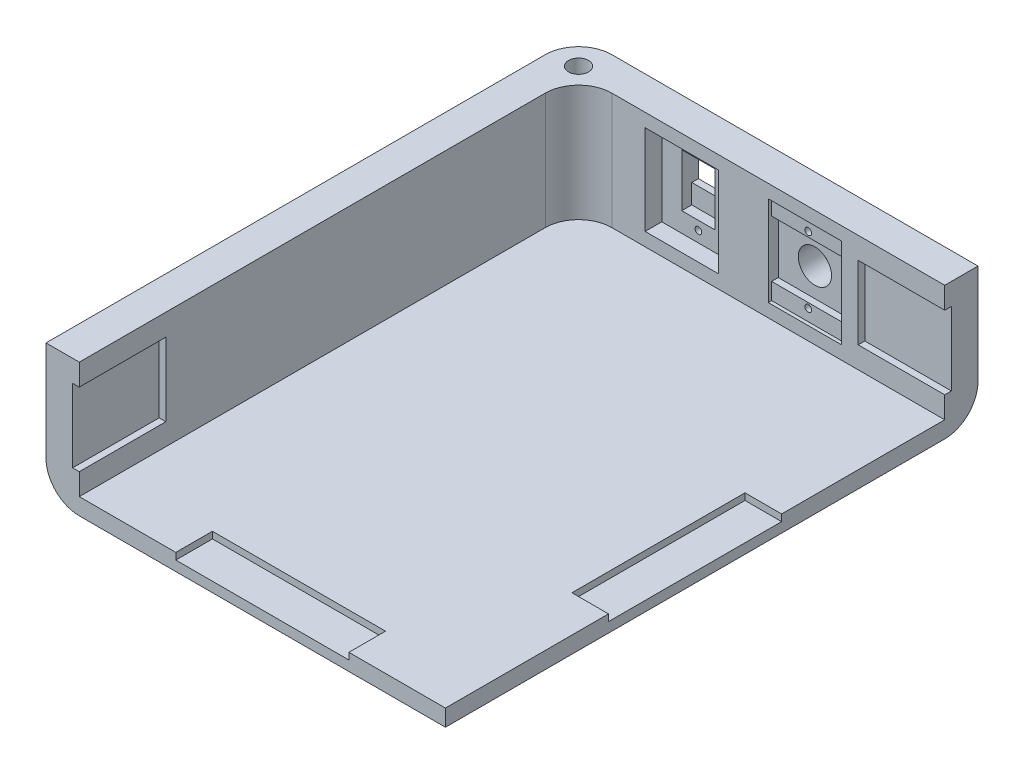
from build123d import *

# Parameters (mm, degrees)
ESQUISSE1_W              = 120
ESQUISSE1_H              = 160
BOSS_EXTRU_1_DEPTH       = 40
ESQUISSE2_W              = 110
ESQUISSE2_H              = 150
ENL_V_MAT_EXTRU_1_DEPTH  = 35
CONG_1_R                 = 10
CONG_2_R                 = 10
CONG_3_R                 = 10
ESQUISSE3_R              = 2.5
BOSS_EXTRU_2_DEPTH       = 2.5
CONG_4_R                 = 2.5
ESQUISSE4_R              = 3
ENL_V_MAT_EXTRU_2_DEPTH  = 35
ESQUISSE5_W              = 11
ESQUISSE5_H              = 52
ENL_V_MAT_EXTRU_3_DEPTH  = 2
ESQUISSE6_W              = 52
ESQUISSE6_H              = 11
ENL_V_MAT_EXTRU_4_DEPTH  = 2
ESQUISSE8_W              = 22
ESQUISSE8_H              = 27
ENL_V_MAT_EXTRU_6_DEPTH  = 5
ESQUISSE10_R             = 1
ENL_V_MAT_EXTRU_7_DEPTH  = 4
ESQUISSE11_W             = 10
ESQUISSE11_H             = 10
ENL_V_MAT_EXTRU_8_DEPTH  = 201.062490237
ESQUISSE12_W             = 10
ESQUISSE12_H             = 5.85
ENL_V_MAT_EXTRU_9_DEPTH  = 3
ESQUISSE13_W             = 22
ESQUISSE13_H             = 27
ENL_V_MAT_EXTRU_10_DEPTH = 1
ESQUISSE14_R             = 1
ENL_V_MAT_EXTRU_11_DEPTH = 6
ESQUISSE15_R             = 5
ENL_V_MAT_EXTRU_12_DEPTH = 197.979694385
ESQUISSE16_W             = 22
ESQUISSE16_H             = 17
ENL_V_MAT_EXTRU_13_DEPTH = 2
ESQUISSE17_W             = 26
ESQUISSE17_H             = 22
ENL_V_MAT_EXTRU_14_DEPTH = 2
ESQUISSE18_W             = 26
ESQUISSE18_H             = 22
ENL_V_MAT_EXTRU_15_DEPTH = 2


with BuildPart() as part:
    # Esquisse1 → Boss.-Extru.1 (new body)
    with BuildSketch(Plane(origin=(0, 0, 0), x_dir=(1, 0, 0), z_dir=(0, 1, 0))):
        with Locations((60, 80)):
            Rectangle(ESQUISSE1_W, ESQUISSE1_H)
    extrude(amount=BOSS_EXTRU_1_DEPTH)

    # Esquisse2 → Enlèv. mat.-Extru.1 (cut)
    with BuildSketch(Plane(origin=(0, 40, 0), x_dir=(1, 0, 0), z_dir=(0, 1, 0))):
        with Locations((65, 75)):
            Rectangle(ESQUISSE2_W, ESQUISSE2_H)
    extrude(amount=-ENL_V_MAT_EXTRU_1_DEPTH, mode=Mode.SUBTRACT)

    # Congé1
    cong_1_edges = [part.edges().sort_by_distance(p)[0] for p in [
        (60, 0, -160),
    ]]
    fillet(cong_1_edges, radius=CONG_1_R)

    # Congé2
    cong_2_edges = [part.edges().sort_by_distance(p)[0] for p in [
        (0, 0, -75),
        (0, 2.928932188, -157.071067812),
        (0, 25, -160),
    ]]
    fillet(cong_2_edges, radius=CONG_2_R)

    # Congé3
    cong_3_edges = [part.edges().sort_by_distance(p)[0] for p in [
        (10, 22.5, -150),
    ]]
    fillet(cong_3_edges, radius=CONG_3_R)

    # Esquisse3 → Boss.-Extru.2 (add)
    with BuildSketch(Plane.XZ):
        with Locations(Location((30, -130, 0), (0, 0, 270))):
            Circle(ESQUISSE3_R)
    extrude(amount=BOSS_EXTRU_2_DEPTH)

    # Congé4
    cong_4_edges = [part.edges().sort_by_distance(p)[0] for p in [
        (30, -2.5, -127.5),
    ]]
    fillet(cong_4_edges, radius=CONG_4_R - 0.0001)  # a hair under: the kernel refuses the full size

    # Esquisse4 → Enlèv. mat.-Extru.2 (cut)
    with BuildSketch(Plane(origin=(0, 40, 0), x_dir=(1, 0, 0), z_dir=(0, 1, 0))):
        with Locations(Location((8, 152, 0), (0, 0, 270))):
            Circle(ESQUISSE4_R)
    extrude(amount=-ENL_V_MAT_EXTRU_2_DEPTH, mode=Mode.SUBTRACT)

    # Esquisse5 → Enlèv. mat.-Extru.3 (cut)
    with BuildSketch(Plane(origin=(0, 5, 0), x_dir=(1, 0, 0), z_dir=(0, 1, 0))):
        with Locations((114.5, 75)):
            Rectangle(ESQUISSE5_W, ESQUISSE5_H)
    extrude(amount=-ENL_V_MAT_EXTRU_3_DEPTH, mode=Mode.SUBTRACT)

    # Esquisse6 → Enlèv. mat.-Extru.4 (cut)
    with BuildSketch(Plane(origin=(0, 5, 0), x_dir=(1, 0, 0), z_dir=(0, 1, 0))):
        with Locations((65, 5.5)):
            Rectangle(ESQUISSE6_W, ESQUISSE6_H)
    extrude(amount=-ENL_V_MAT_EXTRU_4_DEPTH, mode=Mode.SUBTRACT)

    # Esquisse8 → Enlèv. mat.-Extru.6 (cut)
    with BuildSketch(Plane.XY.offset(-150)):
        with Locations((41, 22.5)):
            Rectangle(ESQUISSE8_W, ESQUISSE8_H)
    extrude(amount=-ENL_V_MAT_EXTRU_6_DEPTH, mode=Mode.SUBTRACT)

    # Esquisse10 → Enlèv. mat.-Extru.7 (cut)
    with BuildSketch(Plane.XY.offset(-155)):
        with Locations((41, 32.75)):
            Circle(ESQUISSE10_R)
        with Locations((41, 12.25)):
            Circle(ESQUISSE10_R)
    extrude(amount=-ENL_V_MAT_EXTRU_7_DEPTH, mode=Mode.SUBTRACT)

    # Esquisse11 → Enlèv. mat.-Extru.8 (cut, through all)
    with BuildSketch(Plane.XY.offset(-155)):
        with Locations((41, 25.75)):
            Rectangle(ESQUISSE11_W, ESQUISSE11_H)
    extrude(amount=-ENL_V_MAT_EXTRU_8_DEPTH, mode=Mode.SUBTRACT)

    # Esquisse12 → Enlèv. mat.-Extru.9 (cut)
    with BuildSketch(Plane.XY.offset(-155)):
        with Locations((41, 17.825)):
            Rectangle(ESQUISSE12_W, ESQUISSE12_H)
    extrude(amount=-ENL_V_MAT_EXTRU_9_DEPTH, mode=Mode.SUBTRACT)

    # Esquisse13 → Enlèv. mat.-Extru.10 (cut)
    with BuildSketch(Plane.XY.offset(-150)):
        with Locations((78, 22.5)):
            Rectangle(ESQUISSE13_W, ESQUISSE13_H)
    extrude(amount=-ENL_V_MAT_EXTRU_10_DEPTH, mode=Mode.SUBTRACT)

    # Esquisse14 → Enlèv. mat.-Extru.11 (cut)
    with BuildSketch(Plane.XY.offset(-151)):
        with Locations((78, 32.5)):
            Circle(ESQUISSE14_R)
        with Locations((78, 12.5)):
            Circle(ESQUISSE14_R)
    extrude(amount=-ENL_V_MAT_EXTRU_11_DEPTH, mode=Mode.SUBTRACT)

    # Esquisse15 → Enlèv. mat.-Extru.12 (cut, through all)
    with BuildSketch(Plane.XY.offset(-151)):
        with Locations((78, 22.5)):
            Circle(ESQUISSE15_R)
    extrude(amount=-ENL_V_MAT_EXTRU_12_DEPTH, mode=Mode.SUBTRACT)

    # Esquisse16 → Enlèv. mat.-Extru.13 (cut)
    with BuildSketch(Plane.XY.offset(-151)):
        with Locations((78, 22.5)):
            Rectangle(ESQUISSE16_W, ESQUISSE16_H)
    extrude(amount=-ENL_V_MAT_EXTRU_13_DEPTH, mode=Mode.SUBTRACT)

    # Esquisse17 → Enlèv. mat.-Extru.14 (cut)
    with BuildSketch(Plane.XY.offset(-150)):
        with Locations((107, 22.5)):
            Rectangle(ESQUISSE17_W, ESQUISSE17_H)
    extrude(amount=-ENL_V_MAT_EXTRU_14_DEPTH, mode=Mode.SUBTRACT)

    # Esquisse18 → Enlèv. mat.-Extru.15 (cut)
    with BuildSketch(Plane(origin=(10, 0, 0), x_dir=(0, 0, -1), z_dir=(1, 0, 0))):
        with Locations((13, 22.5)):
            Rectangle(ESQUISSE18_W, ESQUISSE18_H)
    extrude(amount=-ENL_V_MAT_EXTRU_15_DEPTH, mode=Mode.SUBTRACT)


solid = part.part
